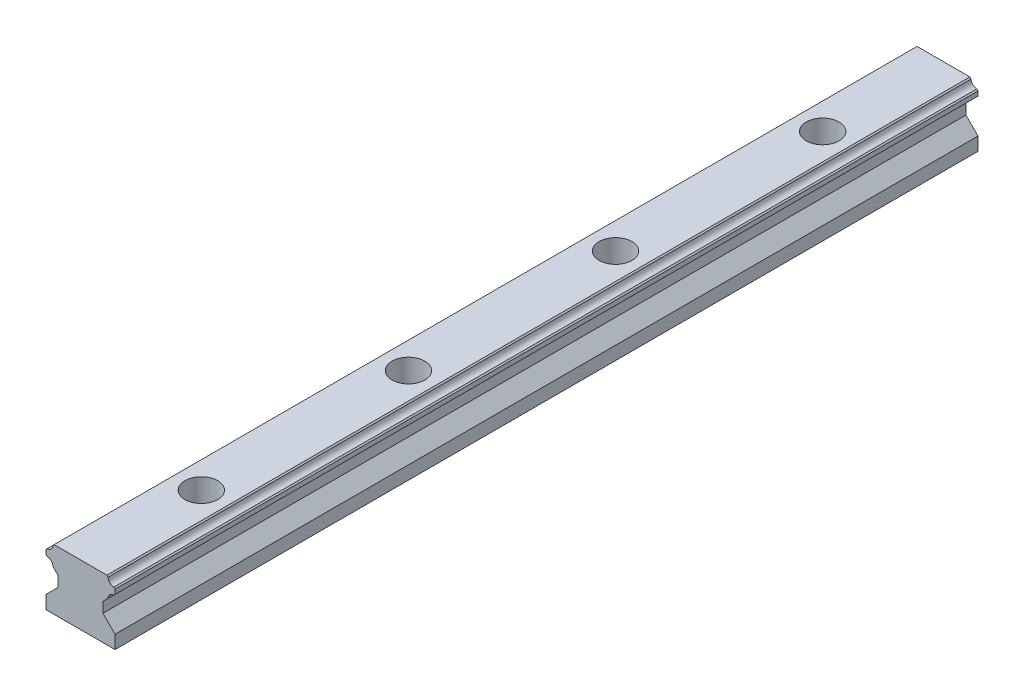
from build123d import *

# Parameters (mm, degrees)
BOSS_EXTRUDE1_DEPTH = 125
SKETCH2_R           = 3
CUT_EXTRUDE1_DEPTH  = 127.614572621
SKETCH3_R           = 4.75
CUT_EXTRUDE2_DEPTH  = 8.5
LPATTERN1_COUNT     = 100
LPATTERN1_PITCH     = 60


with BuildPart() as part:
    # Sketch1 → Boss-Extrude1 (new body)
    with BuildSketch(Plane.XY):
        with BuildLine():
            Line((-6.5, -4.15), (-6.5, -7.15))
            Line((-6.5, -7.15), (-10, -10.65))
            Line((-10, -10.65), (-10, -14.5))
            Line((-10, -14.5), (0, -14.5))
            Line((0, -14.5), (0, 3))
            Line((0, 3), (-7.65, 3))
            Line((-7.65, 3), (-8.003553391, 2.646446609))
            ThreePointArc((-8.003553391, 2.646446609), (-8.484745674, 1.484745674), (-9.646446609, 1.003553391))
            Line((-9.646446609, 1.003553391), (-10, 0.65))
            Line((-10, 0.65), (-10, -0.65))
            Line((-10, -0.65), (-9.646446609, -1.003553391))
            ThreePointArc((-9.646446609, -1.003553391), (-8.484745674, -1.484745674), (-8.003553391, -2.646446609))
            Line((-8.003553391, -2.646446609), (-6.5, -4.15))
        make_face()
    boss_extrude1 = extrude(amount=BOSS_EXTRUDE1_DEPTH)

    # Mirror1: Boss-Extrude1 across plane
    add(boss_extrude1.mirror(Plane(origin=(0, 3, 125), x_dir=(0, 0, 1), z_dir=(-1, 0, 0))))

    # Sketch2 → Cut-Extrude1 (cut, through all)
    with BuildSketch(Plane(origin=(0, 3, 0), x_dir=(1, 0, 0), z_dir=(0, 1, 0))):
        with Locations((0, -30)):
            Circle(SKETCH2_R)
    cut_extrude1 = extrude(amount=-CUT_EXTRUDE1_DEPTH, mode=Mode.SUBTRACT)

    # Sketch3 → Cut-Extrude2 (cut)
    with BuildSketch(Plane(origin=(0, 3, 0), x_dir=(1, 0, 0), z_dir=(0, 1, 0))):
        with Locations((0, -30)):
            Circle(SKETCH3_R)
    cut_extrude2 = extrude(amount=-CUT_EXTRUDE2_DEPTH, mode=Mode.SUBTRACT)

    # LPattern1: Cut-Extrude1, Cut-Extrude2 ×100
    with Locations(*[(0, 0, i * LPATTERN1_PITCH) for i in range(1, LPATTERN1_COUNT)]):
        add(cut_extrude1, mode=Mode.SUBTRACT)
        add(cut_extrude2, mode=Mode.SUBTRACT)

    # Mirror2: part across plane


with BuildPart() as part_1:
    add(part.part)
    add(part.part.mirror(Plane(origin=(-9.646446609, -2.646446609, 0), x_dir=(1, 0, 0), z_dir=(0, 0, -1))))


solid = part_1.part
